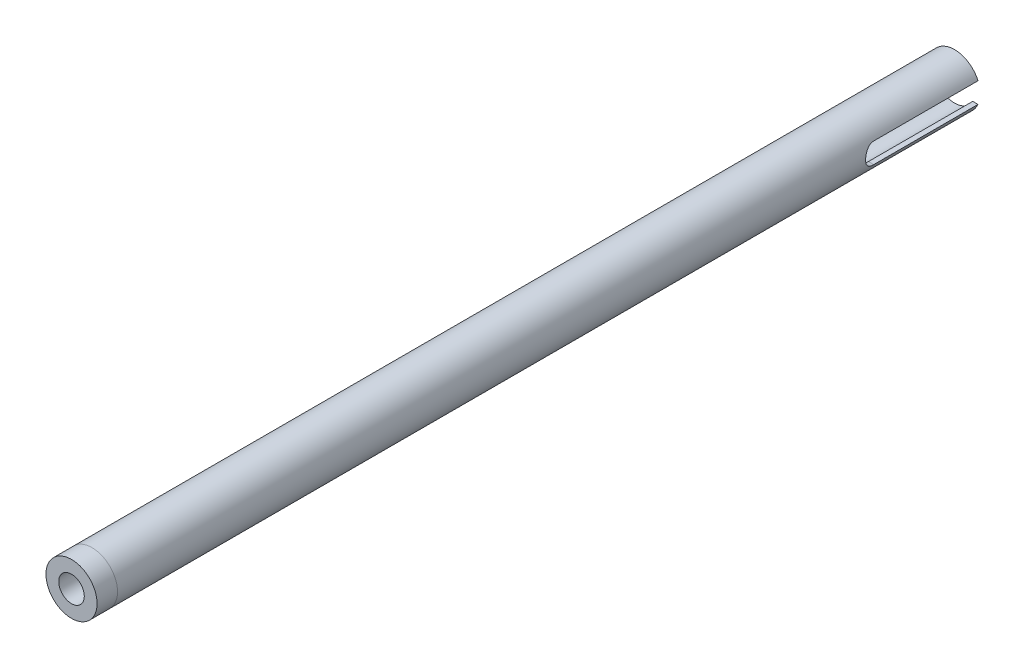
from build123d import *

# Parameters (mm, degrees)
THREADED_INSERT_1_1_DEPTH = 6.35
THREADED_START            = -6.35
THREADED_INSERT_1_2_DEPTH = 9.525
A_ARM_START               = -6.35
A_ARM_TUBE_DEPTH          = 267.858037
APEX_START                = -238.648037
APEX_SLOT_DEPTH           = 35.56
FILLET1_R                 = 3.175


with BuildPart() as part:
    # Sketch1 → Threaded insert 1-1 (new body)
    with BuildSketch(Plane.XY):
        with BuildLine():
            ThreePointArc((-2.38125, 3.175), (0, 3.96875), (2.38125, 3.175))
            Line((2.38125, 3.175), (5.630856905, 3.175))
            ThreePointArc((5.630856905, 3.175), (0, 6.4643), (-5.630856905, 3.175))
            Line((-5.630856905, 3.175), (-2.38125, 3.175))
        make_face()
        with BuildLine():
            ThreePointArc((-5.630856905, 3.175), (0, 6.4643), (5.630856905, 3.175))
            Line((5.630856905, 3.175), (7.274838916, 3.175))
            ThreePointArc((7.274838916, 3.175), (0, 7.9375), (-7.274838916, 3.175))
            Line((-7.274838916, 3.175), (-5.630856905, 3.175))
        make_face()
        with BuildLine():
            ThreePointArc((2.38125, 3.175), (3.549757914, 1.774878957), (3.96875, 0))
            Line((3.96875, 0), (6.4643, 0))
            ThreePointArc((6.4643, 0), (6.252468424, 1.641283978), (5.630856905, 3.175))
            Line((5.630856905, 3.175), (2.38125, 3.175))
        make_face()
        with BuildLine():
            Line((-6.4643, 0), (-3.96875, 0))
            ThreePointArc((-3.96875, 0), (-3.549757914, 1.774878957), (-2.38125, 3.175))
            Line((-2.38125, 3.175), (-5.630856905, 3.175))
            ThreePointArc((-5.630856905, 3.175), (-6.252468424, 1.641283978), (-6.4643, 0))
        make_face()
        with BuildLine():
            ThreePointArc((5.630856905, 3.175), (6.252468424, 1.641283978), (6.4643, 0))
            Line((6.4643, 0), (7.9375, 0))
            ThreePointArc((7.9375, 0), (7.770068859, 1.621707797), (7.274838916, 3.175))
            Line((7.274838916, 3.175), (5.630856905, 3.175))
        make_face()
        with BuildLine():
            Line((-7.9375, 0), (-6.4643, 0))
            ThreePointArc((-6.4643, 0), (-6.252468424, 1.641283978), (-5.630856905, 3.175))
            Line((-5.630856905, 3.175), (-7.274838916, 3.175))
            ThreePointArc((-7.274838916, 3.175), (-7.770068859, 1.621707797), (-7.9375, 0))
        make_face()
        with BuildLine():
            Line((7.9375, 0), (6.4643, 0))
            ThreePointArc((6.4643, 0), (6.252468424, -1.641283978), (5.630856905, -3.175))
            Line((5.630856905, -3.175), (7.274838916, -3.175))
            ThreePointArc((7.274838916, -3.175), (7.770068859, -1.621707797), (7.9375, 0))
        make_face()
        with BuildLine():
            ThreePointArc((-5.630856905, -3.175), (-6.252468424, -1.641283978), (-6.4643, 0))
            Line((-6.4643, 0), (-7.9375, 0))
            ThreePointArc((-7.9375, 0), (-7.770068859, -1.621707797), (-7.274838916, -3.175))
            Line((-7.274838916, -3.175), (-5.630856905, -3.175))
        make_face()
        with BuildLine():
            Line((6.4643, 0), (3.96875, 0))
            ThreePointArc((3.96875, 0), (3.549757914, -1.774878957), (2.38125, -3.175))
            Line((2.38125, -3.175), (5.630856905, -3.175))
            ThreePointArc((5.630856905, -3.175), (6.252468424, -1.641283978), (6.4643, 0))
        make_face()
        with BuildLine():
            ThreePointArc((-2.38125, -3.175), (-3.549757914, -1.774878957), (-3.96875, 0))
            Line((-3.96875, 0), (-6.4643, 0))
            ThreePointArc((-6.4643, 0), (-6.252468424, -1.641283978), (-5.630856905, -3.175))
            Line((-5.630856905, -3.175), (-2.38125, -3.175))
        make_face()
        with BuildLine():
            Line((5.630856905, -3.175), (2.38125, -3.175))
            ThreePointArc((2.38125, -3.175), (0, -3.96875), (-2.38125, -3.175))
            Line((-2.38125, -3.175), (-5.630856905, -3.175))
            ThreePointArc((-5.630856905, -3.175), (0, -6.4643), (5.630856905, -3.175))
        make_face()
        with BuildLine():
            Line((7.274838916, -3.175), (5.630856905, -3.175))
            ThreePointArc((5.630856905, -3.175), (0, -6.4643), (-5.630856905, -3.175))
            Line((-5.630856905, -3.175), (-7.274838916, -3.175))
            ThreePointArc((-7.274838916, -3.175), (0, -7.9375), (7.274838916, -3.175))
        make_face()
    extrude(amount=-THREADED_INSERT_1_1_DEPTH)

    # Sketch1<3> → Threaded insert 1-2 (add)
    with BuildSketch(Plane.XY.offset(THREADED_START)):
        with BuildLine():
            ThreePointArc((-2.38125, 3.175), (0, 3.96875), (2.38125, 3.175))
            Line((2.38125, 3.175), (5.630856905, 3.175))
            ThreePointArc((5.630856905, 3.175), (0, 6.4643), (-5.630856905, 3.175))
            Line((-5.630856905, 3.175), (-2.38125, 3.175))
        make_face()
        with BuildLine():
            ThreePointArc((2.38125, 3.175), (3.549757914, 1.774878957), (3.96875, 0))
            Line((3.96875, 0), (6.4643, 0))
            ThreePointArc((6.4643, 0), (6.252468424, 1.641283978), (5.630856905, 3.175))
            Line((5.630856905, 3.175), (2.38125, 3.175))
        make_face()
        with BuildLine():
            Line((-6.4643, 0), (-3.96875, 0))
            ThreePointArc((-3.96875, 0), (-3.549757914, 1.774878957), (-2.38125, 3.175))
            Line((-2.38125, 3.175), (-5.630856905, 3.175))
            ThreePointArc((-5.630856905, 3.175), (-6.252468424, 1.641283978), (-6.4643, 0))
        make_face()
        with BuildLine():
            Line((6.4643, 0), (3.96875, 0))
            ThreePointArc((3.96875, 0), (3.549757914, -1.774878957), (2.38125, -3.175))
            Line((2.38125, -3.175), (5.630856905, -3.175))
            ThreePointArc((5.630856905, -3.175), (6.252468424, -1.641283978), (6.4643, 0))
        make_face()
        with BuildLine():
            ThreePointArc((-2.38125, -3.175), (-3.549757914, -1.774878957), (-3.96875, 0))
            Line((-3.96875, 0), (-6.4643, 0))
            ThreePointArc((-6.4643, 0), (-6.252468424, -1.641283978), (-5.630856905, -3.175))
            Line((-5.630856905, -3.175), (-2.38125, -3.175))
        make_face()
        with BuildLine():
            Line((5.630856905, -3.175), (2.38125, -3.175))
            ThreePointArc((2.38125, -3.175), (0, -3.96875), (-2.38125, -3.175))
            Line((-2.38125, -3.175), (-5.630856905, -3.175))
            ThreePointArc((-5.630856905, -3.175), (0, -6.4643), (5.630856905, -3.175))
        make_face()
    extrude(amount=-THREADED_INSERT_1_2_DEPTH)


with BuildPart() as body_2:
    # Sketch1<4> → A-arm tube (new body)
    with BuildSketch(Plane.XY.offset(A_ARM_START)):
        with BuildLine():
            ThreePointArc((-5.630856905, 3.175), (0, 6.4643), (5.630856905, 3.175))
            Line((5.630856905, 3.175), (7.274838916, 3.175))
            ThreePointArc((7.274838916, 3.175), (0, 7.9375), (-7.274838916, 3.175))
            Line((-7.274838916, 3.175), (-5.630856905, 3.175))
        make_face()
        with BuildLine():
            ThreePointArc((5.630856905, 3.175), (6.252468424, 1.641283978), (6.4643, 0))
            Line((6.4643, 0), (7.9375, 0))
            ThreePointArc((7.9375, 0), (7.770068859, 1.621707797), (7.274838916, 3.175))
            Line((7.274838916, 3.175), (5.630856905, 3.175))
        make_face()
        with BuildLine():
            Line((-7.9375, 0), (-6.4643, 0))
            ThreePointArc((-6.4643, 0), (-6.252468424, 1.641283978), (-5.630856905, 3.175))
            Line((-5.630856905, 3.175), (-7.274838916, 3.175))
            ThreePointArc((-7.274838916, 3.175), (-7.770068859, 1.621707797), (-7.9375, 0))
        make_face()
        with BuildLine():
            Line((7.9375, 0), (6.4643, 0))
            ThreePointArc((6.4643, 0), (6.252468424, -1.641283978), (5.630856905, -3.175))
            Line((5.630856905, -3.175), (7.274838916, -3.175))
            ThreePointArc((7.274838916, -3.175), (7.770068859, -1.621707797), (7.9375, 0))
        make_face()
        with BuildLine():
            ThreePointArc((-5.630856905, -3.175), (-6.252468424, -1.641283978), (-6.4643, 0))
            Line((-6.4643, 0), (-7.9375, 0))
            ThreePointArc((-7.9375, 0), (-7.770068859, -1.621707797), (-7.274838916, -3.175))
            Line((-7.274838916, -3.175), (-5.630856905, -3.175))
        make_face()
        with BuildLine():
            Line((7.274838916, -3.175), (5.630856905, -3.175))
            ThreePointArc((5.630856905, -3.175), (0, -6.4643), (-5.630856905, -3.175))
            Line((-5.630856905, -3.175), (-7.274838916, -3.175))
            ThreePointArc((-7.274838916, -3.175), (0, -7.9375), (7.274838916, -3.175))
        make_face()
    extrude(amount=-A_ARM_TUBE_DEPTH)

    # Sketch1<5> → Apex slot (cut)
    with BuildSketch(Plane.XY.offset(APEX_START)):
        with BuildLine():
            ThreePointArc((5.630856905, 3.175), (6.252468424, 1.641283978), (6.4643, 0))
            Line((6.4643, 0), (7.9375, 0))
            ThreePointArc((7.9375, 0), (7.770068859, 1.621707797), (7.274838916, 3.175))
            Line((7.274838916, 3.175), (5.630856905, 3.175))
        make_face()
        with BuildLine():
            Line((-7.9375, 0), (-6.4643, 0))
            ThreePointArc((-6.4643, 0), (-6.252468424, 1.641283978), (-5.630856905, 3.175))
            Line((-5.630856905, 3.175), (-7.274838916, 3.175))
            ThreePointArc((-7.274838916, 3.175), (-7.770068859, 1.621707797), (-7.9375, 0))
        make_face()
        with BuildLine():
            Line((7.9375, 0), (6.4643, 0))
            ThreePointArc((6.4643, 0), (6.252468424, -1.641283978), (5.630856905, -3.175))
            Line((5.630856905, -3.175), (7.274838916, -3.175))
            ThreePointArc((7.274838916, -3.175), (7.770068859, -1.621707797), (7.9375, 0))
        make_face()
        with BuildLine():
            ThreePointArc((-5.630856905, -3.175), (-6.252468424, -1.641283978), (-6.4643, 0))
            Line((-6.4643, 0), (-7.9375, 0))
            ThreePointArc((-7.9375, 0), (-7.770068859, -1.621707797), (-7.274838916, -3.175))
            Line((-7.274838916, -3.175), (-5.630856905, -3.175))
        make_face()
    extrude(amount=-APEX_SLOT_DEPTH, mode=Mode.SUBTRACT)

    # Fillet1
    # the kernel refuses this fillet: 3.175 mm, written as the material it adds along each edge
    with BuildSketch(Plane(origin=(2.306643095, 3.175, -238.648037), x_dir=(0, 0, -1), z_dir=(-1, 0, 0))) as fillet1_piece_1_section:
        with BuildLine():
            CenterArc((FILLET1_R, FILLET1_R), FILLET1_R, 180, 90)
            Line((0, FILLET1_R), (0, 0))
            Line((0, 0), (FILLET1_R, 0))
        make_face()
    fillet1_piece_1 = extrude(amount=17.51898201, mode=Mode.PRIVATE)
    fillet1_piece_1 = fillet1_piece_1 - Plane(origin=(0, 0, -239.36776962), x_dir=(-0.8710698614669244, 0.49115913555994567, 0), z_dir=(0, 0, 1)) * Cylinder(6.4643, 48, mode=Mode.PRIVATE)
    fillet1_piece_1 = fillet1_piece_1 & Plane(origin=(0, 0, -239.36776962), x_dir=(-1, 0, 0), z_dir=(0, 0, 1)) * Cylinder(7.9375, 48, mode=Mode.PRIVATE)
    add(fillet1_piece_1)
    with BuildSketch(Plane(origin=(-15.212338916, -3.175, -238.648037), x_dir=(0, 0, -1), z_dir=(1, 0, 0))) as fillet1_piece_2_section:
        with BuildLine():
            CenterArc((FILLET1_R, FILLET1_R), FILLET1_R, 180, 90)
            Line((0, FILLET1_R), (0, 0))
            Line((0, 0), (FILLET1_R, 0))
        make_face()
    fillet1_piece_2 = extrude(amount=17.51898201, mode=Mode.PRIVATE)
    fillet1_piece_2 = fillet1_piece_2 - Plane(origin=(0, 0, -239.367769783), x_dir=(-0.8710698614669244, 0.49115913555994567, 0), z_dir=(0, 0, 1)) * Cylinder(6.4643, 48, mode=Mode.PRIVATE)
    fillet1_piece_2 = fillet1_piece_2 & Plane(origin=(0, 0, -239.367769783), x_dir=(-1, 0, 0), z_dir=(0, 0, 1)) * Cylinder(7.9375, 48, mode=Mode.PRIVATE)
    add(fillet1_piece_2)
    with BuildSketch(Plane(origin=(-2.306643095, -3.175, -238.648037), x_dir=(0, 0, -1), z_dir=(1, 0, 0))) as fillet1_piece_3_section:
        with BuildLine():
            CenterArc((FILLET1_R, FILLET1_R), FILLET1_R, 180, 90)
            Line((0, FILLET1_R), (0, 0))
            Line((0, 0), (FILLET1_R, 0))
        make_face()
    fillet1_piece_3 = extrude(amount=17.51898201, mode=Mode.PRIVATE)
    fillet1_piece_3 = fillet1_piece_3 - Plane(origin=(0, 0, -239.36776962), x_dir=(-0.8710698614669244, 0.49115913555994567, 0), z_dir=(0, 0, 1)) * Cylinder(6.4643, 48, mode=Mode.PRIVATE)
    fillet1_piece_3 = fillet1_piece_3 & Plane(origin=(0, 0, -239.36776962), x_dir=(-1, 0, 0), z_dir=(0, 0, 1)) * Cylinder(7.9375, 48, mode=Mode.PRIVATE)
    add(fillet1_piece_3)
    with BuildSketch(Plane(origin=(15.212338916, 3.175, -238.648037), x_dir=(0, -1, 0), z_dir=(-1, 0, 0))) as fillet1_piece_4_section:
        with BuildLine():
            CenterArc((FILLET1_R, -FILLET1_R), FILLET1_R, 90, 90)
            Line((0, -FILLET1_R), (0, 0))
            Line((0, 0), (FILLET1_R, 0))
        make_face()
    fillet1_piece_4 = extrude(amount=17.51898201, mode=Mode.PRIVATE)
    fillet1_piece_4 = fillet1_piece_4 - Plane(origin=(0, 0, -239.367769609), x_dir=(-0.8710698614669244, 0.49115913555994567, 0), z_dir=(0, 0, 1)) * Cylinder(6.4643, 48, mode=Mode.PRIVATE)
    fillet1_piece_4 = fillet1_piece_4 & Plane(origin=(0, 0, -239.367769609), x_dir=(-1, 0, 0), z_dir=(0, 0, 1)) * Cylinder(7.9375, 48, mode=Mode.PRIVATE)
    add(fillet1_piece_4)


solid = Compound([part.part, body_2.part])
